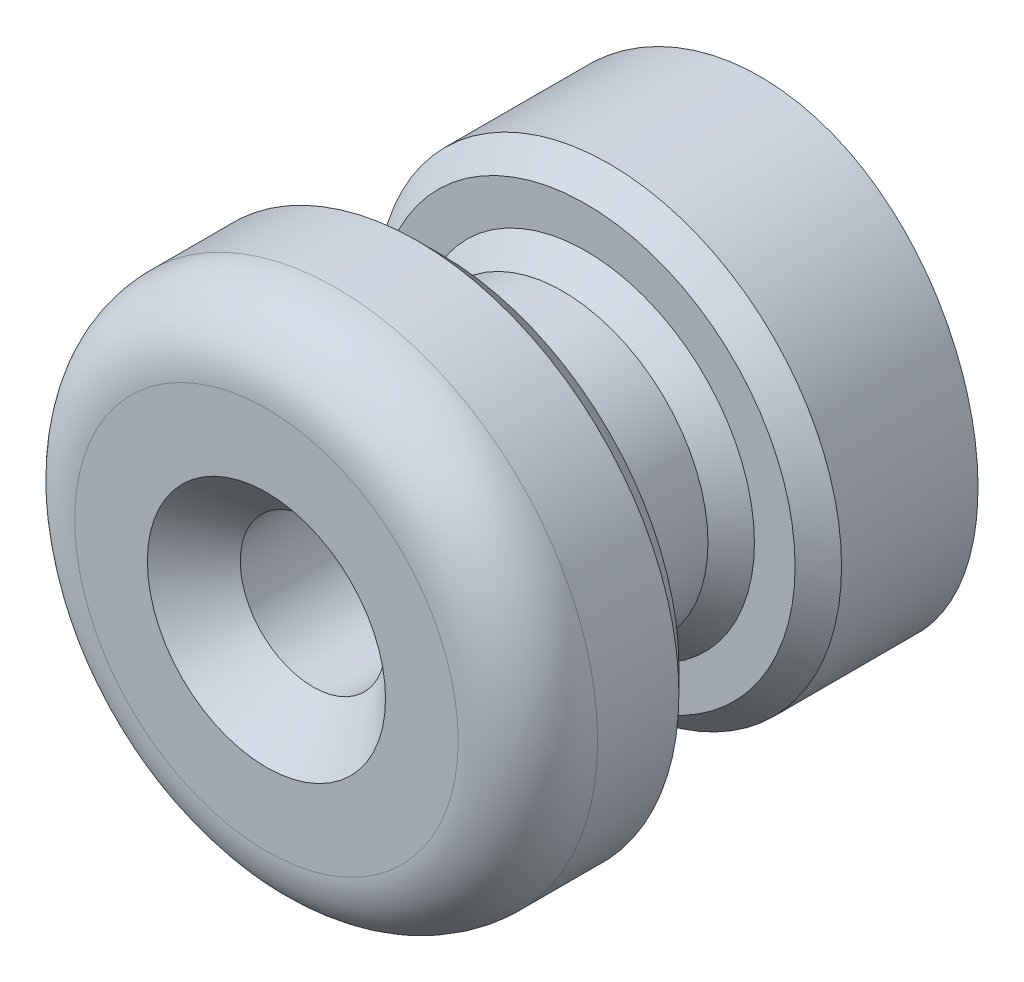
from build123d import *

# Parameters (mm, degrees)
SKETCH1_R               = 5.08
SKETCH1_R_2             = 1.5875
BOSS_EXTRUDE1_DEPTH     = 3.81
SKETCH2_R               = 3.175
SKETCH2_R_2             = 1.5875
BOSS_EXTRUDE2_DEPTH     = 3.175
SKETCH3_R               = 5.715
SKETCH3_R_2             = 1.5875
BOSS_EXTRUDE3_DEPTH     = 3.81
CHAMFER1_SIZE           = 0.508
CHAMFER2_SIZE           = 0.508
FILLET1_R               = 1.524
CHAMFER3_SIZE           = 1.016
CUT_EXTRUDE1_DEPTH      = 14.485343012
CUT_EXTRUDE1_DEPTH_BACK = 14.485343012
SKETCH4_R               = 40.64


with BuildPart() as part:
    # Sketch1 → Boss-Extrude1 (new body)
    with BuildSketch(Plane.XY):
        Circle(SKETCH1_R)
        Circle(SKETCH1_R_2, mode=Mode.SUBTRACT)
    extrude(amount=BOSS_EXTRUDE1_DEPTH)

    # Sketch2 → Boss-Extrude2 (add)
    with BuildSketch(Plane.XY.offset(3.81)):
        Circle(SKETCH2_R)
        Circle(SKETCH2_R_2, mode=Mode.SUBTRACT)
    extrude(amount=BOSS_EXTRUDE2_DEPTH)

    # Sketch3 → Boss-Extrude3 (add)
    with BuildSketch(Plane.XY.offset(6.985)):
        Circle(SKETCH3_R)
        Circle(SKETCH3_R_2, mode=Mode.SUBTRACT)
    extrude(amount=BOSS_EXTRUDE3_DEPTH)

    # Chamfer1
    chamfer1_edges = [part.edges().sort_by_distance(p)[0] for p in [
        (-3.175, 0, 3.81),
        (-3.175, 0, 6.985),
    ]]
    chamfer(chamfer1_edges, length=CHAMFER1_SIZE)

    # Chamfer2
    chamfer2_edges = [part.edges().sort_by_distance(p)[0] for p in [
        (-5.08, 0, 3.81),
        (-5.715, 0, 6.985),
    ]]
    chamfer(chamfer2_edges, length=CHAMFER2_SIZE)

    # Fillet1
    fillet1_edges = [part.edges().sort_by_distance(p)[0] for p in [
        (-5.715, 0, 10.795),
    ]]
    fillet(fillet1_edges, radius=FILLET1_R)

    # Chamfer3
    chamfer3_edges = [part.edges().sort_by_distance(p)[0] for p in [
        (-1.5875, 0, 10.795),
    ]]
    chamfer(chamfer3_edges, length=CHAMFER3_SIZE)

    # Sketch4 → Cut-Extrude1 (cut, two sides: drawn at the far end of the back side and taken through both)
    with BuildSketch(Plane(origin=(0, 0, 0), x_dir=(0, 0, -1), z_dir=(1, 0, 0)).offset(-CUT_EXTRUDE1_DEPTH_BACK)):
        with Locations((40.321249981, 0)):
            Circle(SKETCH4_R)
    extrude(amount=CUT_EXTRUDE1_DEPTH + CUT_EXTRUDE1_DEPTH_BACK, mode=Mode.SUBTRACT)


solid = part.part
